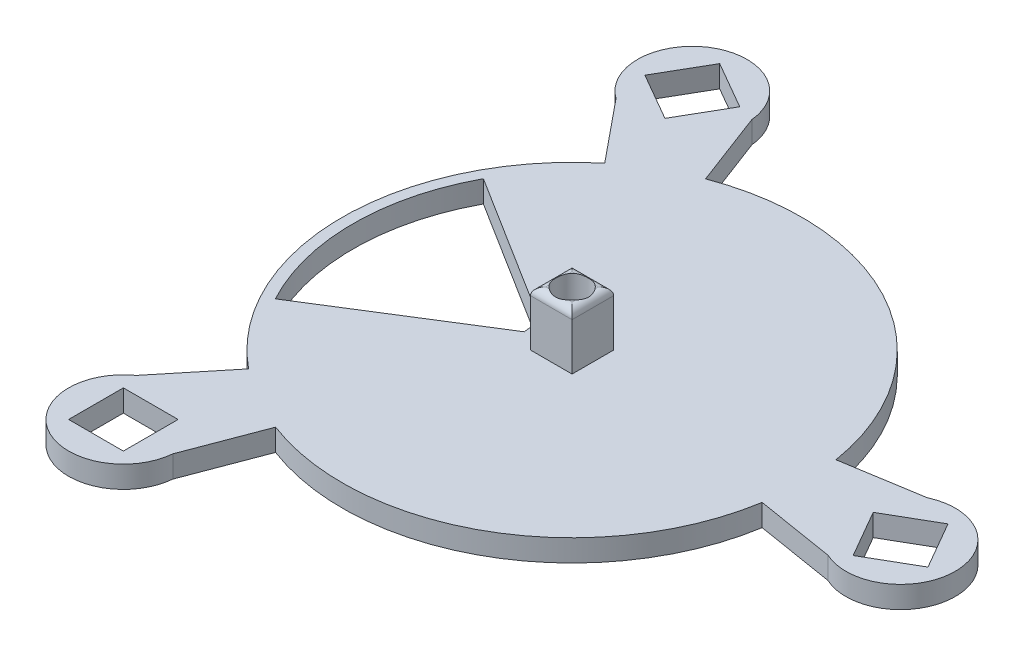
from build123d import *

# Parameters (mm, degrees)
SKETCH1_R           = 21
SKETCH1_W           = 5
SKETCH1_H           = 5
BOSS_EXTRUDE1_DEPTH = 2
SKETCH2_W           = 3.8
SKETCH2_H           = 3.8
BOSS_EXTRUDE2_DEPTH = 5
CUT_EXTRUDE1_REACH  = 49.263
SKETCH3_R           = 1.5
CUT_EXTRUDE2_REACH  = 49.009
FILLET1_R           = 0.7


with BuildPart() as part:
    # Sketch1 → Boss-Extrude1 (new body)
    # profile 1 of 6: a face of its own
    with BuildSketch(Plane(origin=(0, 0, 0), x_dir=(1, 0, 0), z_dir=(0, 1, 0))):
        Circle(SKETCH1_R)
    # profile 2 of 6: a face of its own
    with BuildSketch(Plane(origin=(0, 0, 0), x_dir=(1, 0, 0), z_dir=(0, 1, 0))):
        with BuildLine():
            Line((0, 0), (-17.886625066, -21.898189918))
            ThreePointArc((-17.886625066, -21.898189918), (-17.5, -30.310889132), (-10.021076233, -26.439366654))
            Line((-10.021076233, -26.439366654), (0, 0))
        make_face()
        with Locations((-15, -25.980762114)):
            Rectangle(SKETCH1_W, SKETCH1_H, mode=Mode.SUBTRACT)
    # profile 3 of 6: a face of its own
    with BuildSketch(Plane(origin=(0, 0, 0), x_dir=(1, 0, 0), z_dir=(0, 1, 0))):
        Circle(SKETCH1_R)
    # profile 4 of 6: a face of its own
    with BuildSketch(Plane(origin=(0, 0, 0), x_dir=(1, 0, 0), z_dir=(0, 1, 0))):
        with BuildLine():
            Line((0, 0), (27.907701299, -4.541176736))
            ThreePointArc((27.907701299, -4.541176736), (35, 0), (27.907701299, 4.541176736))
            Line((27.907701299, 4.541176736), (0, 0))
        make_face()
        Polygon((29.084936491, -3.415063509), (26.584936491, 0.915063509), (30.915063509, 3.415063509), (33.415063509, -0.915063509), align=None, mode=Mode.SUBTRACT)
    # profile 5 of 6: a face of its own
    with BuildSketch(Plane(origin=(0, 0, 0), x_dir=(1, 0, 0), z_dir=(0, 1, 0))):
        Circle(SKETCH1_R)
    # profile 6 of 6: a face of its own
    with BuildSketch(Plane(origin=(0, 0, 0), x_dir=(1, 0, 0), z_dir=(0, 1, 0))):
        with BuildLine():
            Line((0, 0), (-10.021076233, 26.439366654))
            ThreePointArc((-10.021076233, 26.439366654), (-17.5, 30.310889132), (-17.886625066, 21.898189918))
            Line((-17.886625066, 21.898189918), (0, 0))
        make_face()
        Polygon((-11.584936491, 26.895825623), (-14.084936491, 22.565698604), (-18.415063509, 25.065698604), (-15.915063509, 29.395825623), align=None, mode=Mode.SUBTRACT)
    extrude(amount=BOSS_EXTRUDE1_DEPTH)

    # Sketch2 → Boss-Extrude2 (add)
    with BuildSketch(Plane(origin=(0, 2, 0), x_dir=(1, 0, 0), z_dir=(0, 1, 0))):
        Rectangle(SKETCH2_W, SKETCH2_H)
    extrude(amount=BOSS_EXTRUDE2_DEPTH)

    # Sketch3 → Cut-Extrude1 (cut, up to next)
    with BuildSketch(Plane(origin=(0, 7, 0), x_dir=(1, 0, 0), z_dir=(0, 1, 0)), mode=Mode.PRIVATE) as cut_extrude1_sk1:
        with Locations(Location((0, 0, 0), (0, 0, 270))):
            Circle(SKETCH3_R)
    cut_extrude1_tool1 = extrude(cut_extrude1_sk1.sketch, amount=-CUT_EXTRUDE1_REACH, mode=Mode.PRIVATE) & part.part
    add(cut_extrude1_tool1.solids().sort_by_distance((0, 7, 0))[0], mode=Mode.SUBTRACT)

    # Sketch4 → Cut-Extrude2 (cut, up to next)
    with BuildSketch(Plane(origin=(0, 2, 0), x_dir=(1, 0, 0), z_dir=(0, 1, 0)), mode=Mode.PRIVATE) as cut_extrude2_sk1:
        with BuildLine():
            Line((-3.620274752, -0.735), (-17.599715907, -9.5))
            ThreePointArc((-17.599715907, -9.5), (-20, 0), (-17.599715907, 9.5))
            Line((-17.599715907, 9.5), (-3.620274752, 0.735))
            ThreePointArc((-3.620274752, 0.735), (-3.694132412, 0), (-3.620274752, -0.735))
        make_face()
    cut_extrude2_tool1 = extrude(cut_extrude2_sk1.sketch, amount=-CUT_EXTRUDE2_REACH, mode=Mode.PRIVATE) & part.part
    add(cut_extrude2_tool1.solids().sort_by_distance((-13.664779, 2, 0))[0], mode=Mode.SUBTRACT)

    # Fillet1
    # the kernel refuses this fillet: 0.7 mm, written as the material it takes off along each edge
    with BuildSketch(Plane(origin=(-1.9, 7, 3.65), x_dir=(0, -1, 0), z_dir=(0, 0, -1)), Plane(origin=(3.65, 7, 1.9), x_dir=(0, -1, 0), z_dir=(-1, 0, 0)), Plane(origin=(1.9, 7, -3.65), x_dir=(0, -1, 0), z_dir=(0, 0, 1)), Plane(origin=(-3.65, 7, -1.9), x_dir=(0, -1, 0), z_dir=(1, 0, 0))) as fillet1_piece_1:
        with BuildLine():
            CenterArc((FILLET1_R, -FILLET1_R), FILLET1_R, 90, 90)
            Line((0, -FILLET1_R), (0, 0))
            Line((0, 0), (FILLET1_R, 0))
        make_face()
    extrude(amount=7.3, mode=Mode.SUBTRACT)


solid = part.part
